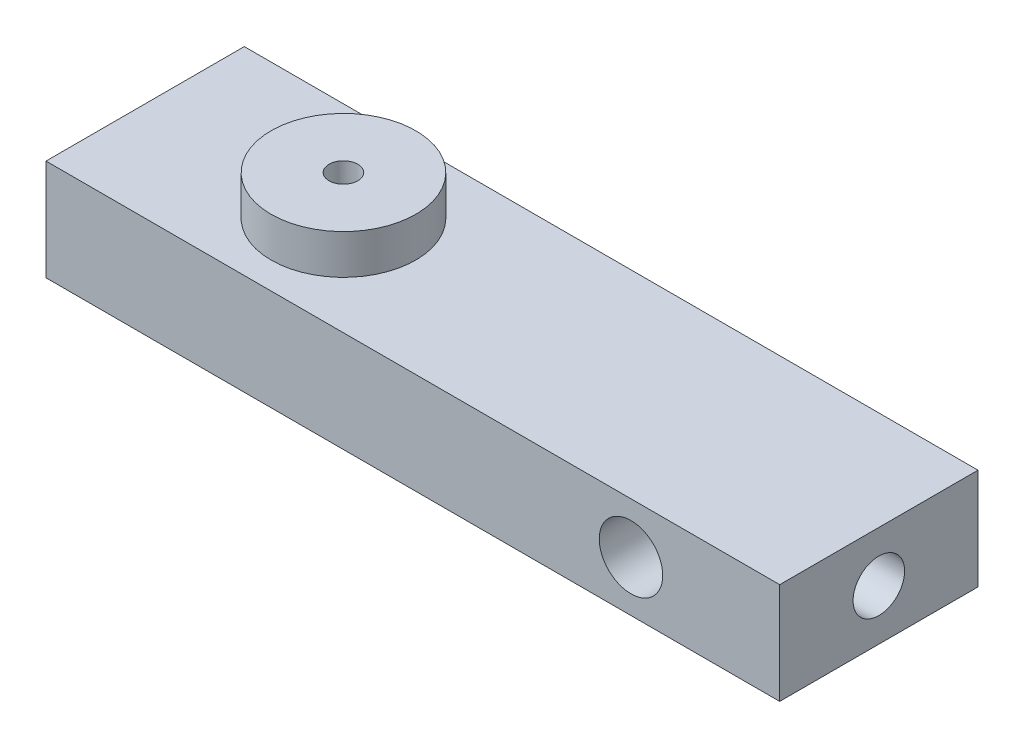
from build123d import *

# Parameters (mm, degrees)
SKETCH_1_W          = 15
SKETCH_1_H          = 10
EXTRUDE_1_DEPTH     = 5.1
SKETCH_2_R          = 1.6
CUT_EXTRUDE_1_DEPTH = 14.500370365
SKETCH_3_R          = 1.3
CUT_EXTRUDE_2_DEPTH = 3.8
CUT_EXTRUDE_3_REACH = 15.283
SKETCH_4_R          = 0.575
SKETCH_5_W          = 10
SKETCH_5_H          = 5.1
EXTRUDE_2_DEPTH     = 22
SKETCH_6_R          = 3.65
EXTRUDE_3_DEPTH     = 2
SKETCH_7_R          = 0.725
CUT_EXTRUDE_4_DEPTH = 31.751585341


with BuildPart() as part:
    # 草图1 → 凸台-拉伸1 (new body)
    with BuildSketch(Plane(origin=(0, 0, 0), x_dir=(1, 0, 0), z_dir=(0, 1, 0))):
        Rectangle(SKETCH_1_W, SKETCH_1_H)
    extrude(amount=EXTRUDE_1_DEPTH)

    # 草图2 → 切除-拉伸1 (cut, through all)
    with BuildSketch(Plane.XY.offset(5)):
        with Locations((0, 2.55)):
            Circle(SKETCH_2_R)
    extrude(amount=-CUT_EXTRUDE_1_DEPTH, mode=Mode.SUBTRACT)

    # 草图3 → 切除-拉伸2 (cut)
    with BuildSketch(Plane(origin=(7.5, 0, 0), x_dir=(0, 0, -1), z_dir=(1, 0, 0))):
        with Locations((0, 2.55)):
            Circle(SKETCH_3_R)
    extrude(amount=-CUT_EXTRUDE_2_DEPTH, mode=Mode.SUBTRACT)

    # 草图4 → 切除-拉伸3 (cut, up to next)
    with BuildSketch(Plane(origin=(3.7, 0, 0), x_dir=(0, 0, -1), z_dir=(1, 0, 0)), mode=Mode.PRIVATE) as cut_extrude_3_sk1:
        with Locations((0, 2.55)):
            Circle(SKETCH_4_R)
    cut_extrude_3_tool1 = extrude(cut_extrude_3_sk1.sketch, amount=-CUT_EXTRUDE_3_REACH, mode=Mode.PRIVATE) & part.part
    add(cut_extrude_3_tool1.solids().sort_by_distance((3.7, 2.55, 0))[0], mode=Mode.SUBTRACT)

    # 草图5 → 凸台-拉伸2 (add)
    with BuildSketch(Plane.ZY.offset(7.5)):
        with Locations((0, 2.55)):
            Rectangle(SKETCH_5_W, SKETCH_5_H)
    extrude(amount=EXTRUDE_2_DEPTH)

    # 草图6 → 凸台-拉伸3 (add)
    with BuildSketch(Plane(origin=(0, 5.1, 0), x_dir=(1, 0, 0), z_dir=(0, 1, 0))):
        with Locations((-19.5, 0)):
            Circle(SKETCH_6_R)
    extrude(amount=EXTRUDE_3_DEPTH)

    # 草图7 → 切除-拉伸4 (cut, through all)
    with BuildSketch(Plane(origin=(0, 7.1, 0), x_dir=(1, 0, 0), z_dir=(0, 1, 0))):
        with Locations((-19.5, 0)):
            Circle(SKETCH_7_R)
    extrude(amount=-CUT_EXTRUDE_4_DEPTH, mode=Mode.SUBTRACT)


solid = part.part
